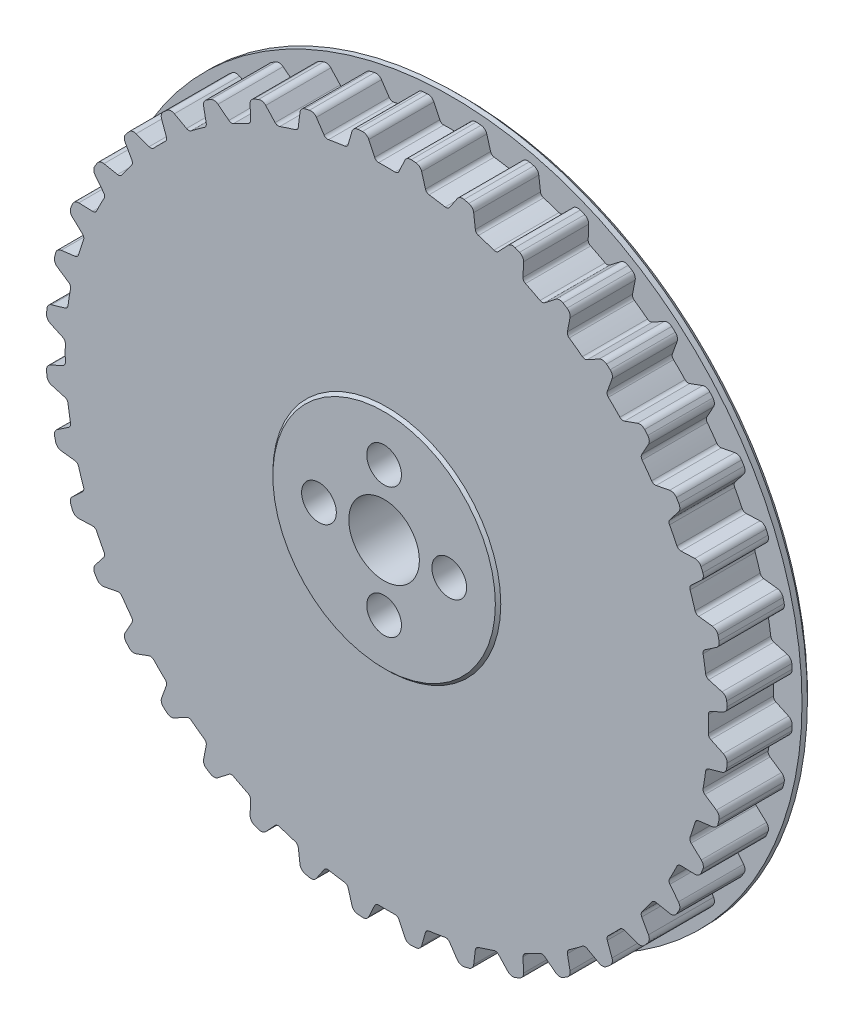
from build123d import *

# Parameters (mm, degrees)
EXTRUDE_1_DEPTH          = 6
PATTERN_CIRCULAR_1_COUNT = 40
SKETCH_4_R               = 32.25
EXTRUDE_3_DEPTH          = 1
SKETCH_2_R               = 3.25
SKETCH_2_R_2             = 1.6
CUT_EXTRUDE_2_DEPTH      = 47.142442501
CHAMFER_1_SIZE           = 2
EXTRUDE_START            = 0.25
SKETCH_5_R               = 10
SKETCH_5_R_2             = 3.25
SKETCH_5_R_3             = 1.6
EXTRUDE_4_DEPTH          = 0.25
CHAMFER_3_SIZE           = 0.5
CHAMFER_4_SIZE           = 0.5


with BuildPart() as part:
    # ｽｹｯﾁ1 → ﾎﾞｽ - 押し出し1 (new body)
    with BuildSketch(Plane.XY):
        with BuildLine():
            Line((-1.122649697, 29.846329298), (-1.660456297, 30.999659273))
            ThreePointArc((-1.660456297, 30.999659273), (-1.90017201, 31.263333005), (-2.247145903, 31.344552322))
            ThreePointArc((-2.247145903, 31.344552322), (-2.356375805, 31.33653009), (-2.465577083, 31.328127213))
            Line((-2.465577083, 31.328127213), (-0.392295479, 4.984586669))
            ThreePointArc((-0.392295479, 4.984586669), (0, -5), (0.392295479, 4.984586669))
            Line((0.392295479, 4.984586669), (2.465577083, 31.328127213))
            ThreePointArc((2.465577083, 31.328127213), (2.356375805, 31.33653009), (2.247145903, 31.344552322))
            ThreePointArc((2.247145903, 31.344552322), (1.90017201, 31.263333005), (1.660456297, 30.999659273))
            Line((1.660456297, 30.999659273), (1.122649697, 29.846329298))
            ThreePointArc((1.122649697, 29.846329298), (0.970758525, 29.675326334), (0.75, 29.615504807))
            ThreePointArc((0.75, 29.615504807), (0, 29.625), (-0.75, 29.615504807))
            ThreePointArc((-0.75, 29.615504807), (-0.970758525, 29.675326334), (-1.122649697, 29.846329298))
        make_face()
    extrude_1 = extrude(amount=EXTRUDE_1_DEPTH)

    # 円形ﾊﾟﾀｰﾝ1: ﾎﾞｽ - 押し出し1 ×40 about axis
    pattern_circular_1_axis = Axis((0, 0, 0), (0, 0, 1))
    for i in range(1, PATTERN_CIRCULAR_1_COUNT):
        add(extrude_1.rotate(pattern_circular_1_axis, i * 360 / PATTERN_CIRCULAR_1_COUNT))

    # ｽｹｯﾁ4 → ﾎﾞｽ - 押し出し3 (add)
    with BuildSketch(Plane(origin=(0, 0, 0), x_dir=(-1, 0, 0), z_dir=(0, 0, -1))):
        Circle(SKETCH_4_R)
    extrude(amount=EXTRUDE_3_DEPTH)

    # ｽｹｯﾁ2 → ｶｯﾄ - 押し出し2 (cut, through all)
    with BuildSketch(Plane.XY.offset(6)):
        Circle(SKETCH_2_R)
        with Locations((0, 6)):
            Circle(SKETCH_2_R_2)
        with Locations((6, 0)):
            Circle(SKETCH_2_R_2)
        with Locations((0, -6)):
            Circle(SKETCH_2_R_2)
        with Locations((-6, 0)):
            Circle(SKETCH_2_R_2)
    extrude(amount=-CUT_EXTRUDE_2_DEPTH, mode=Mode.SUBTRACT)

    # 面取り1
    # the kernel refuses this chamfer: 2 mm, written as the material it takes off along each edge
    with BuildSketch(Plane(origin=(0, 6, -1), x_dir=(1, 0, 0), z_dir=(0, -1, 0))) as chamfer_1_piece_1:
        Polygon((1.6 + CHAMFER_1_SIZE, 0), (1.6, CHAMFER_1_SIZE), (1.6, 0), align=None)
    revolve(axis=Axis((0, 6, -1), (0, 0, 1)), mode=Mode.SUBTRACT)
    with BuildSketch(Plane(origin=(6, 0, -1), x_dir=(1, 0, 0), z_dir=(0, -1, 0))) as chamfer_1_piece_2:
        Polygon((1.6 + CHAMFER_1_SIZE, 0), (1.6, CHAMFER_1_SIZE), (1.6, 0), align=None)
    revolve(axis=Axis((6, 0, -1), (0, 0, 1)), mode=Mode.SUBTRACT)
    with BuildSketch(Plane(origin=(0, -6, -1), x_dir=(1, 0, 0), z_dir=(0, -1, 0))) as chamfer_1_piece_3:
        Polygon((1.6 + CHAMFER_1_SIZE, 0), (1.6, CHAMFER_1_SIZE), (1.6, 0), align=None)
    revolve(axis=Axis((0, -6, -1), (0, 0, 1)), mode=Mode.SUBTRACT)
    with BuildSketch(Plane(origin=(-6, 0, -1), x_dir=(1, 0, 0), z_dir=(0, -1, 0))) as chamfer_1_piece_4:
        Polygon((1.6 + CHAMFER_1_SIZE, 0), (1.6, CHAMFER_1_SIZE), (1.6, 0), align=None)
    revolve(axis=Axis((-6, 0, -1), (0, 0, 1)), mode=Mode.SUBTRACT)

    # ｽｹｯﾁ5 → ﾎﾞｽ - 押し出し4 (add)
    with BuildSketch(Plane.XY.offset(6).offset(EXTRUDE_START)):
        Circle(SKETCH_5_R)
        Circle(SKETCH_5_R_2, mode=Mode.SUBTRACT)
        with Locations((6, 0)):
            Circle(SKETCH_5_R_3, mode=Mode.SUBTRACT)
        with Locations((0, -6)):
            Circle(SKETCH_5_R_3, mode=Mode.SUBTRACT)
        with Locations((0, 6)):
            Circle(SKETCH_5_R_3, mode=Mode.SUBTRACT)
        with Locations((-6, 0)):
            Circle(SKETCH_5_R_3, mode=Mode.SUBTRACT)
    extrude(amount=-EXTRUDE_4_DEPTH)

    # 面取り3
    # the kernel refuses this chamfer: 0.5 mm, written as the material it adds along each edge
    with BuildSketch(Plane(origin=(0, 0, 6), x_dir=(1, 0, 0), z_dir=(0, -1, 0))) as chamfer_3_piece_1_section:
        Polygon((10, CHAMFER_3_SIZE), (10 + CHAMFER_3_SIZE, 0), (10, 0), align=None)
    chamfer_3_piece_1 = revolve(axis=Axis((0, 0, 6), (0, 0, 1)), mode=Mode.PRIVATE)
    chamfer_3_piece_1 = split(chamfer_3_piece_1, bisect_by=Plane(origin=(-10.368840224, 0, 6.25), z_dir=(0, 0, -1)), keep=Keep.TOP, mode=Mode.PRIVATE)
    add(chamfer_3_piece_1)

    # 面取り4
    chamfer_4_edges = [part.edges().sort_by_distance(p)[0] for p in [
        (32.25, 0, -1),
    ]]
    chamfer(chamfer_4_edges, length=CHAMFER_4_SIZE)


solid = part.part
